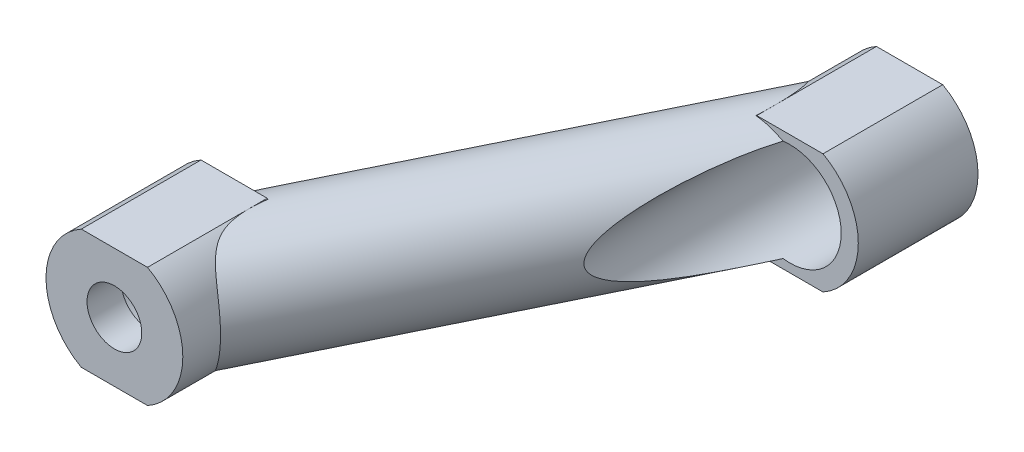
from build123d import *

# Parameters (mm, degrees)
BOSS_EXTRUDE1_DEPTH      = 2
BOSS_EXTRUDE1_DEPTH_BACK = 5
SKETCH3_R                = 4
BOSS_EXTRUDE2_DEPTH      = 5
BOSS_EXTRUDE2_DEPTH_BACK = 2
SKETCH2_R                = 4
BOSS_EXTRUDE3_START      = -13.929206
SKETCH4_R                = 3.5
BOSS_EXTRUDE3_DEPTH      = 27.858412
CUT_EXTRUDE1_DEPTH       = 29.057975838
CUT_EXTRUDE1_DEPTH_BACK  = 5
SKETCH5_R                = 3
CUT_EXTRUDE2_DEPTH       = 29.057975747
CUT_EXTRUDE2_DEPTH_BACK  = 5
SKETCH6_R                = 3
SKETCH7_R                = 1.6
CUT_EXTRUDE3_DEPTH       = 33.668792587
SKETCH8_R                = 1.6
CUT_EXTRUDE4_DEPTH       = 33.668792494
SPLIT1_START             = -4.0000001
SPLIT1_OUTLINE_W         = 20
SPLIT1_OUTLINE_H         = 8.75
SPLIT1_DEPTH             = 0.5000001
SPLIT1_START_2           = 3.5
SPLIT1_2_OUTLINE_W       = 20
SPLIT1_2_OUTLINE_H       = 8.75
SPLIT1_2_DEPTH           = 0.5
SPLIT1_START_3           = -16.25
SPLIT1_3_DEPTH           = 7
SPLIT1_START_4           = 9.25
SPLIT1_4_DEPTH           = 7
SPLIT1_5_DEPTH           = 7
SPLIT1_6_DEPTH           = 7


# Read off the part's stored shape, not the designer's step: Split1
with BuildPart() as part:
    # Sketch3 → Boss-Extrude1 (new, two sides: drawn at the far end of the back side and taken through both)
    with BuildSketch(Plane(origin=(-7, 0, 14.25), x_dir=(1, 0, 0), z_dir=(0, 0, 1)).offset(-BOSS_EXTRUDE1_DEPTH_BACK)):
        Circle(SKETCH3_R)
    extrude(amount=BOSS_EXTRUDE1_DEPTH + BOSS_EXTRUDE1_DEPTH_BACK)



with BuildPart() as body_2:
    # Sketch2 → Boss-Extrude2 (new, two sides: drawn at the far end of the back side and taken through both)
    with BuildSketch(Plane(origin=(7, 0, -14.25), x_dir=(1, 0, 0), z_dir=(0, 0, 1)).offset(-BOSS_EXTRUDE2_DEPTH_BACK)):
        Circle(SKETCH2_R)
    extrude(amount=BOSS_EXTRUDE2_DEPTH + BOSS_EXTRUDE2_DEPTH_BACK)


with BuildPart() as part_1:
    add(part.part)

    add(body_2.part)  # Boss-Extrude3 merges body 2
    # Sketch4 → Boss-Extrude3 (add)
    with BuildSketch(Plane(origin=(0, 0, 0), x_dir=(-0.8975543264374148, 0, -0.44090387965346695), z_dir=(0.44090387965346695, 0, -0.8975543264374148)).offset(BOSS_EXTRUDE3_START)):
        with Locations(Location((0, 0, 0), (0, 0, 276.975190017))):
            Circle(SKETCH4_R)
    extrude(amount=BOSS_EXTRUDE3_DEPTH)

    # Sketch5 → Cut-Extrude1 (cut, two sides: drawn at the far end of the back side and taken through both)
    with BuildSketch(Plane.XY.offset(-9.25).offset(-CUT_EXTRUDE1_DEPTH_BACK)):
        with Locations(Location((7, 0, 0), (0, 0, 97.643118007))):
            Circle(SKETCH5_R)
    extrude(amount=CUT_EXTRUDE1_DEPTH + CUT_EXTRUDE1_DEPTH_BACK, mode=Mode.SUBTRACT)

    # Sketch6 → Cut-Extrude2 (cut, two sides: drawn at the far end of the back side and taken through both)
    with BuildSketch(Plane(origin=(0, 0, 9.25), x_dir=(-1, 0, 0), z_dir=(0, 0, -1)).offset(-CUT_EXTRUDE2_DEPTH_BACK)):
        with Locations(Location((7, 0, 0), (0, 0, 97.643118007))):
            Circle(SKETCH6_R)
    extrude(amount=CUT_EXTRUDE2_DEPTH + CUT_EXTRUDE2_DEPTH_BACK, mode=Mode.SUBTRACT)

    # Sketch7 → Cut-Extrude3 (cut, through all)
    with BuildSketch(Plane.XY.offset(-14.25)):
        with Locations((7, 0)):
            Circle(SKETCH7_R)
    extrude(amount=-CUT_EXTRUDE3_DEPTH, mode=Mode.SUBTRACT)

    # Sketch8 → Cut-Extrude4 (cut, through all)
    with BuildSketch(Plane(origin=(0, 0, 14.25), x_dir=(-1, 0, 0), z_dir=(0, 0, -1))):
        with Locations((7, 0)):
            Circle(SKETCH8_R)
    extrude(amount=-CUT_EXTRUDE4_DEPTH, mode=Mode.SUBTRACT)

    # Split1 outline → Split1 (cut)
    with BuildSketch(Plane(origin=(0, 0, 0), x_dir=(1, 0, 0), z_dir=(0, 1, 0)).offset(SPLIT1_START)):
        with Locations((0, -13.625)):
            Rectangle(SPLIT1_OUTLINE_W, SPLIT1_OUTLINE_H)
        with Locations((0, 13.625)):
            Rectangle(SPLIT1_OUTLINE_W, SPLIT1_OUTLINE_H)
    extrude(amount=SPLIT1_DEPTH, mode=Mode.SUBTRACT)

    # Split1 2 outline → Split1 2 (cut)
    with BuildSketch(Plane(origin=(0, 0, 0), x_dir=(1, 0, 0), z_dir=(0, 1, 0)).offset(SPLIT1_START_2)):
        with Locations((0, -13.625)):
            Rectangle(SPLIT1_2_OUTLINE_W, SPLIT1_2_OUTLINE_H)
        with Locations((0, 13.625)):
            Rectangle(SPLIT1_2_OUTLINE_W, SPLIT1_2_OUTLINE_H)
    extrude(amount=SPLIT1_2_DEPTH, mode=Mode.SUBTRACT)


with BuildPart() as body_2_2:
    # Split1 3 outline → Split1 3 (new body)
    with BuildSketch(Plane.XY.offset(SPLIT1_START_3)):
        with BuildLine():
            ThreePointArc((5.063508327, -3.5), (7, -4), (8.936491673, -3.5))
            Line((8.936491673, -3.5), (5.063508327, -3.5))
        make_face()
    extrude(amount=SPLIT1_3_DEPTH)


with BuildPart() as body_3:
    # Split1 4 outline → Split1 4 (new body)
    with BuildSketch(Plane.XY.offset(SPLIT1_START_4)):
        with BuildLine():
            ThreePointArc((-8.936491673, -3.5), (-7, -4), (-5.063508327, -3.5))
            Line((-5.063508327, -3.5), (-8.936491673, -3.5))
        make_face()
    extrude(amount=SPLIT1_4_DEPTH)


with BuildPart() as body_4:
    # Split1 5 outline → Split1 5 (new body)
    with BuildSketch(Plane.XY.offset(SPLIT1_START_4)):
        with BuildLine():
            Line((-8.936491673, 3.5), (-5.063508327, 3.5))
            ThreePointArc((-5.063508327, 3.5), (-7, 4), (-8.936491673, 3.5))
        make_face()
    extrude(amount=SPLIT1_5_DEPTH)


with BuildPart() as body_5:
    # Split1 6 outline → Split1 6 (new body)
    with BuildSketch(Plane.XY.offset(SPLIT1_START_3)):
        with BuildLine():
            Line((5.063508327, 3.5), (8.936491673, 3.5))
            ThreePointArc((8.936491673, 3.5), (7, 4), (5.063508327, 3.5))
        make_face()
    extrude(amount=SPLIT1_6_DEPTH)


solid = part_1.part
